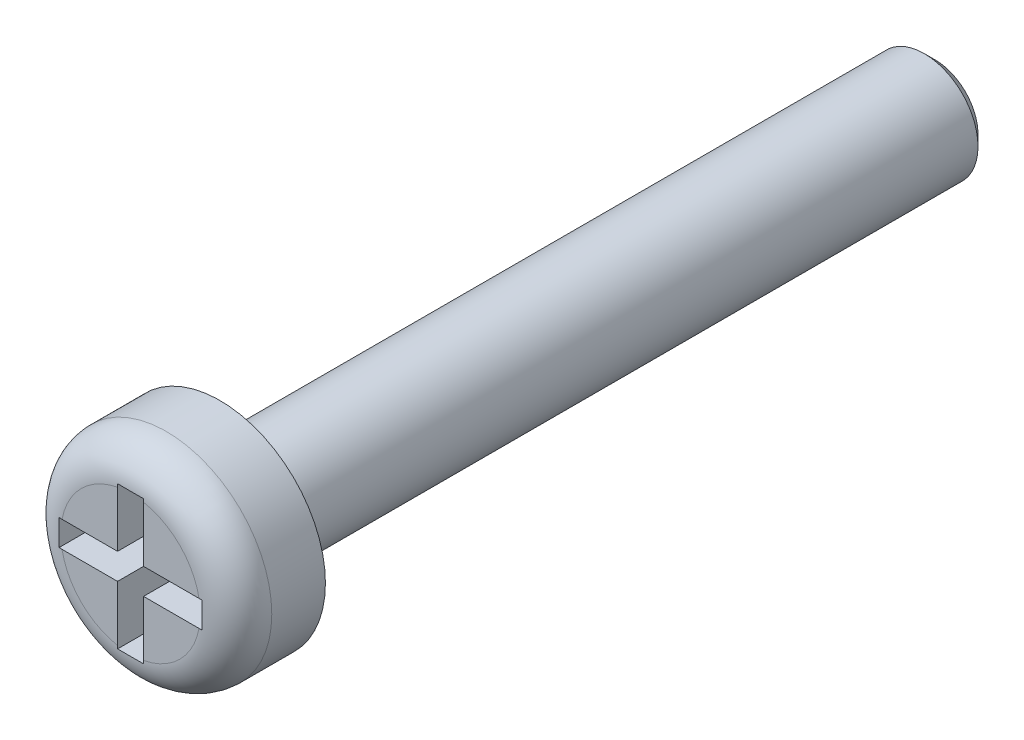
from build123d import *

# Parameters (mm, degrees)
SKETCH1_R           = 2.95
BOSS_EXTRUDE1_DEPTH = 2.5
SKETCH2_R           = 1.5
BOSS_EXTRUDE2_DEPTH = 20
CHAMFER1_SIZE       = 0.3
CUT_EXTRUDE1_DEPTH  = 2
FILLET1_R           = 1


with BuildPart() as part:
    # Sketch1 → Boss-Extrude1 (new body)
    with BuildSketch(Plane.XY):
        Circle(SKETCH1_R)
    extrude(amount=BOSS_EXTRUDE1_DEPTH)

    # Sketch2 → Boss-Extrude2 (add)
    with BuildSketch(Plane(origin=(0, 0, 0), x_dir=(-1, 0, 0), z_dir=(0, 0, -1))):
        with Locations(Location((0, 0, 0), (0, 0, 180))):
            Circle(SKETCH2_R)
    extrude(amount=BOSS_EXTRUDE2_DEPTH)

    # Chamfer1
    chamfer1_edges = [part.edges().sort_by_distance(p)[0] for p in [
        (-1.5, 0, -20),
    ]]
    chamfer(chamfer1_edges, length=CHAMFER1_SIZE)

    # Sketch3 → Cut-Extrude1 (cut)
    with BuildSketch(Plane.XY.offset(2.5)):
        Polygon((0.363589324, 0.363589324), (2, 0.363589324), (2, -0.363589324), (0.363589324, -0.363589324), (0.363589324, -2), (-0.363589324, -2), (-0.363589324, -0.363589324), (-2, -0.363589324), (-2, 0.363589324), (-0.363589324, 0.363589324), (-0.363589324, 2), (0.363589324, 2), align=None)
    extrude(amount=-CUT_EXTRUDE1_DEPTH, mode=Mode.SUBTRACT)

    # Fillet1
    # the kernel refuses this fillet: 1 mm, written as the material it takes off along each edge
    with BuildSketch(Plane(origin=(0, 0, 2.5), x_dir=(1, 0, 0), z_dir=(0, -1, 0))) as fillet1_piece_1:
        with BuildLine():
            CenterArc((2.95 - FILLET1_R, -FILLET1_R), FILLET1_R, 0, 90)
            Line((2.95 - FILLET1_R, 0), (2.95, 0))
            Line((2.95, 0), (2.95, -FILLET1_R))
        make_face()
    revolve(axis=Axis((0, 0, 2.5), (0, 0, 1)), mode=Mode.SUBTRACT)


solid = part.part
